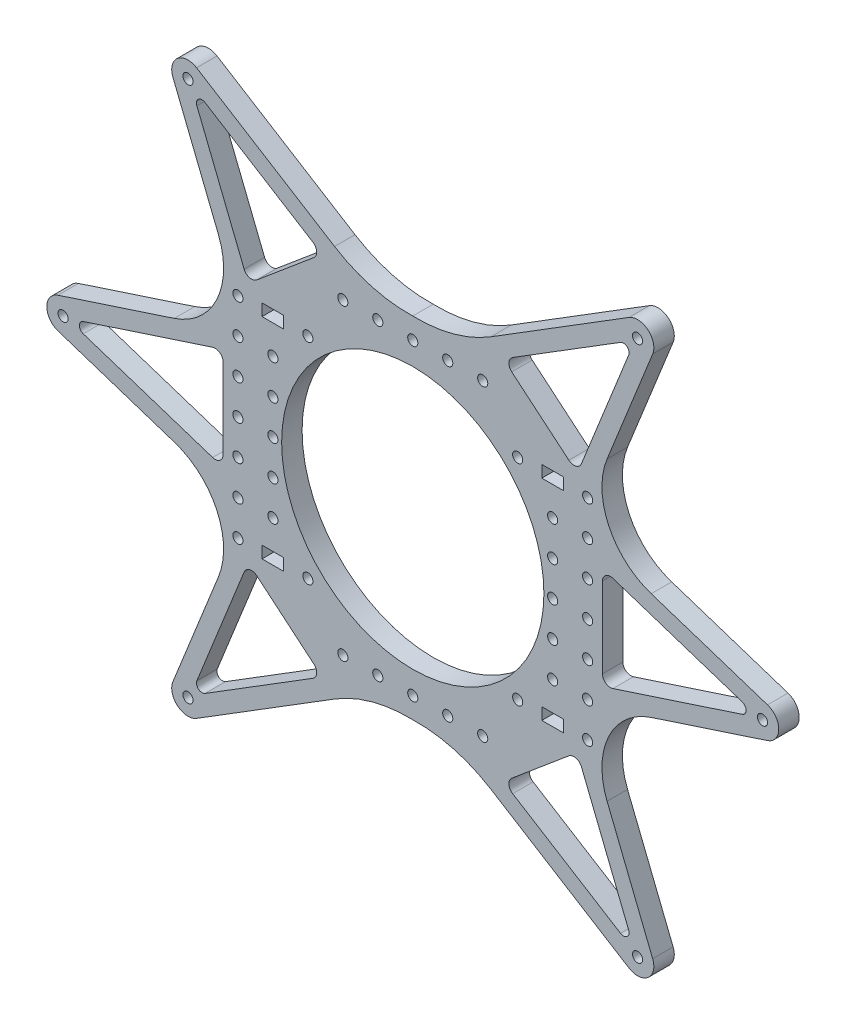
from build123d import *

# Parameters (mm, degrees)
SKETCH1_R           = 1.450000006
SKETCH1_R_2         = 1.45
SKETCH1_R_3         = 37.5
SKETCH1_W           = 6.2
SKETCH1_H           = 3.4
BOSS_EXTRUDE1_DEPTH = 5.85


with BuildPart() as part:
    # Sketch1 → Boss-Extrude1 (new body)
    with BuildSketch(Plane.XY):
        with BuildLine():
            Line((587.995290395, 497.753361998), (601.026388312, 465.269666287))
            ThreePointArc((601.026388312, 465.269666287), (600.580353033, 449.003385667), (588.406365105, 438.205939183))
            Line((588.406365105, 438.205939183), (555.146182231, 427.30822221))
            ThreePointArc((555.146182231, 427.30822221), (551.939243509, 422.882775531), (555.146182231, 418.457328853))
            Line((555.146182231, 418.457328853), (588.406367854, 407.559610979))
            ThreePointArc((588.406367854, 407.559610979), (600.580355203, 396.762164655), (601.026389676, 380.495884554))
            Line((601.026389676, 380.495884554), (587.995289652, 348.012189688))
            ThreePointArc((587.995289652, 348.012189688), (589.323998163, 342.710908478), (594.775468811, 342.322943856))
            Line((594.775468811, 342.322943856), (634.235886777, 366.845341905))
            ThreePointArc((634.235886777, 366.845341905), (644.97165132, 371.509880432), (656.596182238, 372.882775531))
            ThreePointArc((656.596182238, 372.882775531), (668.220713155, 371.509880432), (678.956477699, 366.845341905))
            Line((678.956477699, 366.845341905), (718.416895665, 342.322943856))
            ThreePointArc((718.416895665, 342.322943856), (723.868366313, 342.710908478), (725.197074824, 348.012189688))
            Line((725.197074824, 348.012189688), (712.1659748, 380.495884554))
            ThreePointArc((712.1659748, 380.495884554), (712.612009273, 396.762164655), (724.785996622, 407.559610979))
            Line((724.785996622, 407.559610979), (758.046182244, 418.457328853))
            ThreePointArc((758.046182244, 418.457328853), (761.253120966, 422.882775531), (758.046182244, 427.30822221))
            Line((758.046182244, 427.30822221), (724.785999371, 438.205939183))
            ThreePointArc((724.785999371, 438.205939183), (712.612011443, 449.003385667), (712.165976164, 465.269666287))
            Line((712.165976164, 465.269666287), (725.197074081, 497.753361998))
            ThreePointArc((725.197074081, 497.753361998), (723.86836572, 503.054641878), (718.416896408, 503.442606583))
            Line((718.416896408, 503.442606583), (678.956477699, 478.92021162))
            ThreePointArc((678.956477699, 478.92021162), (668.220713078, 474.255672819), (656.596182238, 472.882775531))
            ThreePointArc((656.596182238, 472.882775531), (644.971651398, 474.255672819), (634.235886777, 478.92021162))
            Line((634.235886777, 478.92021162), (594.775468067, 503.442606583))
            ThreePointArc((594.775468067, 503.442606583), (589.323998755, 503.054641878), (587.995290395, 497.753361998))
        make_face()
        with Locations((592.317421269, 499.487219843)):
            Circle(SKETCH1_R, mode=Mode.SUBTRACT)
        with Locations((706.596182238, 432.882775531)):
            Circle(SKETCH1_R_2, mode=Mode.SUBTRACT)
        with Locations((706.596182238, 442.882775531)):
            Circle(SKETCH1_R_2, mode=Mode.SUBTRACT)
        with Locations((706.596182238, 452.882775531)):
            Circle(SKETCH1_R_2, mode=Mode.SUBTRACT)
        with Locations((706.596182238, 392.882775531)):
            Circle(SKETCH1_R_2, mode=Mode.SUBTRACT)
        with Locations((556.596182238, 422.882775531)):
            Circle(SKETCH1_R, mode=Mode.SUBTRACT)
        with Locations((646.596182238, 378.882775531)):
            Circle(SKETCH1_R_2, mode=Mode.SUBTRACT)
        with Locations((656.596182238, 422.882775531)):
            Circle(SKETCH1_R_3, mode=Mode.SUBTRACT)
        with Locations((636.596182238, 378.882775531)):
            Circle(SKETCH1_R_2, mode=Mode.SUBTRACT)
        with Locations((706.596182238, 402.882775531)):
            Circle(SKETCH1_R_2, mode=Mode.SUBTRACT)
        with Locations((656.596182238, 466.882775531)):
            Circle(SKETCH1_R_2, mode=Mode.SUBTRACT)
        with Locations((696.596182238, 432.882775531)):
            Circle(SKETCH1_R_2, mode=Mode.SUBTRACT)
        with Locations((592.317421269, 346.278331219)):
            Circle(SKETCH1_R, mode=Mode.SUBTRACT)
        with Locations((706.596182238, 412.882775531)):
            Circle(SKETCH1_R_2, mode=Mode.SUBTRACT)
        with Locations((656.596182238, 378.882775531)):
            Circle(SKETCH1_R_2, mode=Mode.SUBTRACT)
        with Locations((696.596182238, 442.882775531)):
            Circle(SKETCH1_R_2, mode=Mode.SUBTRACT)
        with Locations((696.596182238, 402.882775531)):
            Circle(SKETCH1_R_2, mode=Mode.SUBTRACT)
        with Locations((696.596182238, 412.882775531)):
            Circle(SKETCH1_R_2, mode=Mode.SUBTRACT)
        with Locations((646.596182238, 466.882775531)):
            Circle(SKETCH1_R_2, mode=Mode.SUBTRACT)
        with Locations((636.596182238, 466.882775531)):
            Circle(SKETCH1_R_2, mode=Mode.SUBTRACT)
        with Locations((696.596182238, 422.882775531)):
            Circle(SKETCH1_R_2, mode=Mode.SUBTRACT)
        with Locations((676.596182238, 466.882775531)):
            Circle(SKETCH1_R_2, mode=Mode.SUBTRACT)
        with Locations((666.596182238, 466.882775531)):
            Circle(SKETCH1_R_2, mode=Mode.SUBTRACT)
        with Locations((706.596182238, 422.882775531)):
            Circle(SKETCH1_R_2, mode=Mode.SUBTRACT)
        with Locations((686.596182238, 452.882775531)):
            Circle(SKETCH1_R_2, mode=Mode.SUBTRACT)
        with Locations((686.596182238, 392.882775531)):
            Circle(SKETCH1_R_2, mode=Mode.SUBTRACT)
        with Locations((626.596182238, 392.882775531)):
            Circle(SKETCH1_R_2, mode=Mode.SUBTRACT)
        with Locations((720.874943207, 346.278331219)):
            Circle(SKETCH1_R, mode=Mode.SUBTRACT)
        with Locations((676.596182238, 378.882775531)):
            Circle(SKETCH1_R_2, mode=Mode.SUBTRACT)
        with Locations((666.596182238, 378.882775531)):
            Circle(SKETCH1_R_2, mode=Mode.SUBTRACT)
        with Locations((756.596182238, 422.882775531)):
            Circle(SKETCH1_R, mode=Mode.SUBTRACT)
        with Locations((626.596182238, 452.882775531)):
            Circle(SKETCH1_R_2, mode=Mode.SUBTRACT)
        with Locations((606.596182238, 422.882775531)):
            Circle(SKETCH1_R_2, mode=Mode.SUBTRACT)
        with Locations((616.596182238, 422.882775531)):
            Circle(SKETCH1_R_2, mode=Mode.SUBTRACT)
        with Locations((616.596182238, 412.882775531)):
            Circle(SKETCH1_R_2, mode=Mode.SUBTRACT)
        with Locations((720.874943207, 499.487219843)):
            Circle(SKETCH1_R, mode=Mode.SUBTRACT)
        with Locations((616.596182238, 402.882775531)):
            Circle(SKETCH1_R_2, mode=Mode.SUBTRACT)
        with Locations((616.596182238, 442.882775531)):
            Circle(SKETCH1_R_2, mode=Mode.SUBTRACT)
        with Locations((606.596182238, 412.882775531)):
            Circle(SKETCH1_R_2, mode=Mode.SUBTRACT)
        with Locations((616.596182238, 432.882775531)):
            Circle(SKETCH1_R_2, mode=Mode.SUBTRACT)
        with Locations((606.596182238, 402.882775531)):
            Circle(SKETCH1_R_2, mode=Mode.SUBTRACT)
        with Locations((606.596182238, 392.882775531)):
            Circle(SKETCH1_R_2, mode=Mode.SUBTRACT)
        with Locations((606.596182238, 452.882775531)):
            Circle(SKETCH1_R_2, mode=Mode.SUBTRACT)
        with Locations((606.596182238, 442.882775531)):
            Circle(SKETCH1_R_2, mode=Mode.SUBTRACT)
        with Locations((606.596182238, 432.882775531)):
            Circle(SKETCH1_R_2, mode=Mode.SUBTRACT)
        with BuildLine():
            Line((594.852213644, 494.089955534), (608.369257372, 460.394902501))
            ThreePointArc((608.369257372, 460.394902501), (609.936297881, 459.027594122), (611.962982661, 459.494174197))
            Line((611.962982661, 459.494174197), (628.291466753, 473.195399177))
            ThreePointArc((628.291466753, 473.195399177), (629.102888547, 475.11027328), (628.028466383, 476.890937531))
            Line((628.028466383, 476.890937531), (597.192526929, 496.053711548))
            ThreePointArc((597.192526929, 496.053711548), (595.310843783, 495.919797808), (594.852213644, 494.089955534))
        make_face(mode=Mode.SUBTRACT)
        with Locations((696.596182238, 392.882775531)):
            Rectangle(SKETCH1_W, SKETCH1_H, mode=Mode.SUBTRACT)
        with BuildLine():
            Line((562.360059701, 421.35524452), (599.360059701, 409.232174436))
            ThreePointArc((599.360059701, 409.232174436), (601.41475291, 409.553708225), (602.360059701, 411.406150729))
            Line((602.360059701, 411.406150729), (602.360059701, 434.359400333))
            ThreePointArc((602.360059701, 434.359400333), (601.41475291, 436.211842837), (599.360059701, 436.533376627))
            Line((599.360059701, 436.533376627), (562.360059701, 424.410306542))
            ThreePointArc((562.360059701, 424.410306542), (561.253120966, 422.882775531), (562.360059701, 421.35524452))
        make_face(mode=Mode.SUBTRACT)
        with BuildLine():
            Line((594.852214088, 351.675595463), (608.369259622, 385.370646673))
            ThreePointArc((608.369259622, 385.370646673), (609.936300222, 386.737954997), (611.962985024, 386.271374882))
            Line((611.962985024, 386.271374882), (628.29146439, 372.570153869))
            ThreePointArc((628.29146439, 372.570153869), (629.102886227, 370.655279749), (628.028464133, 368.874615419))
            Line((628.028464133, 368.874615419), (597.192526787, 349.711839939))
            ThreePointArc((597.192526787, 349.711839939), (595.310844063, 349.845753588), (594.852214088, 351.675595463))
        make_face(mode=Mode.SUBTRACT)
        with Locations((616.596182238, 452.882775531)):
            Rectangle(SKETCH1_W, SKETCH1_H, mode=Mode.SUBTRACT)
        with Locations((696.596182238, 452.882775531)):
            Rectangle(SKETCH1_W, SKETCH1_H, mode=Mode.SUBTRACT)
        with BuildLine():
            Line((715.999837688, 349.711839939), (685.163900342, 368.874615419))
            ThreePointArc((685.163900342, 368.874615419), (684.089478249, 370.655279749), (684.900900086, 372.570153869))
            Line((684.900900086, 372.570153869), (701.229379452, 386.271374882))
            ThreePointArc((701.229379452, 386.271374882), (703.256064254, 386.737954997), (704.823104853, 385.370646673))
            Line((704.823104853, 385.370646673), (718.340150388, 351.675595463))
            ThreePointArc((718.340150388, 351.675595463), (717.881520413, 349.845753588), (715.999837688, 349.711839939))
        make_face(mode=Mode.SUBTRACT)
        with BuildLine():
            Line((750.832304774, 424.410306542), (713.832304774, 436.533376627))
            ThreePointArc((713.832304774, 436.533376627), (711.777611566, 436.211842837), (710.832304774, 434.359400333))
            Line((710.832304774, 434.359400333), (710.832304774, 411.406150729))
            ThreePointArc((710.832304774, 411.406150729), (711.777611565, 409.553708225), (713.832304774, 409.232174436))
            Line((713.832304774, 409.232174436), (750.832304774, 421.35524452))
            ThreePointArc((750.832304774, 421.35524452), (751.939243509, 422.882775531), (750.832304774, 424.410306542))
        make_face(mode=Mode.SUBTRACT)
        with BuildLine():
            Line((684.900897722, 473.195399177), (701.229381815, 459.494174197))
            ThreePointArc((701.229381815, 459.494174197), (703.256066594, 459.027594122), (704.823107103, 460.394902501))
            Line((704.823107103, 460.394902501), (718.340150832, 494.089955534))
            ThreePointArc((718.340150832, 494.089955534), (717.881520693, 495.919797808), (715.999837547, 496.053711548))
            Line((715.999837547, 496.053711548), (685.163898093, 476.890937531))
            ThreePointArc((685.163898093, 476.890937531), (684.089475929, 475.11027328), (684.900897722, 473.195399177))
        make_face(mode=Mode.SUBTRACT)
        with Locations((616.596182238, 392.882775531)):
            Rectangle(SKETCH1_W, SKETCH1_H, mode=Mode.SUBTRACT)
    extrude(amount=BOSS_EXTRUDE1_DEPTH)


solid = part.part
